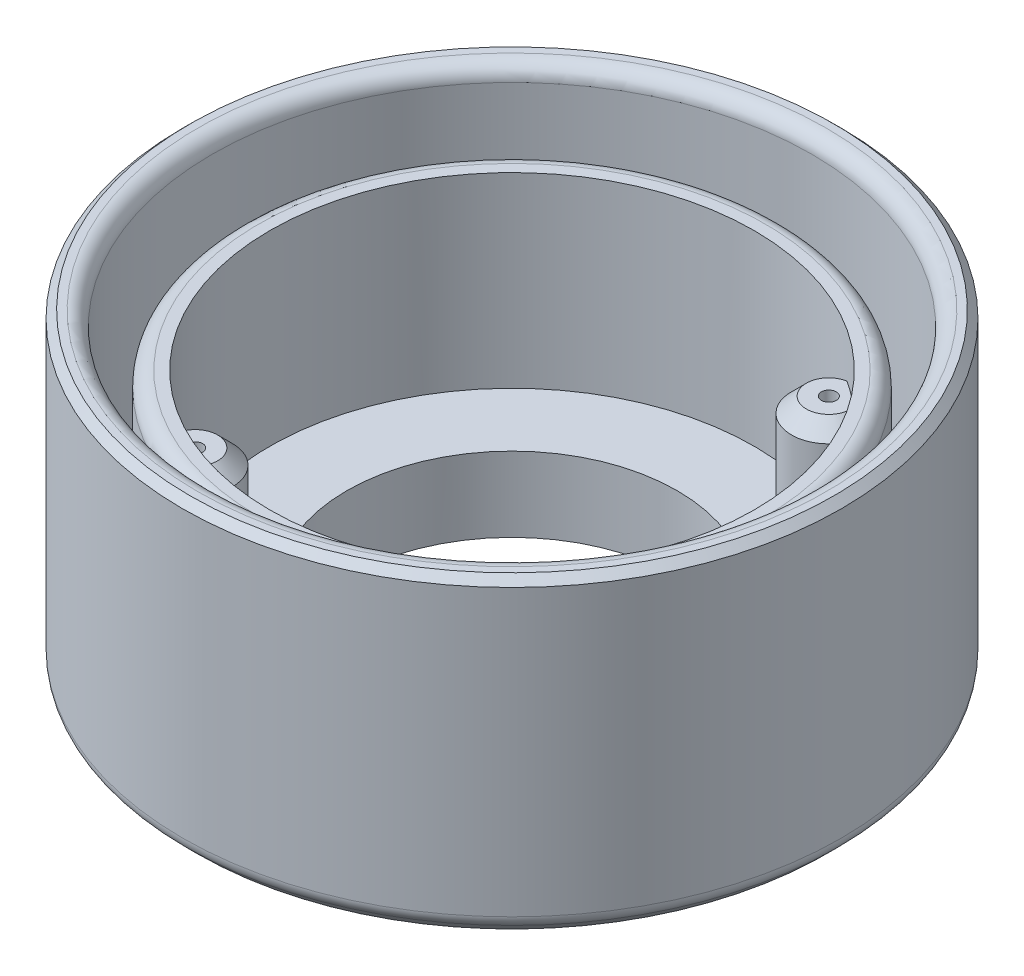
from build123d import *
from OCP.BRepFilletAPI import BRepFilletAPI_MakeChamfer

# Parameters (mm, degrees)
CROQUIS1_R              = 22.05
CROQUIS1_R_2            = 20.05
SALIENTE_EXTRUIR1_DEPTH = 16
CROQUIS1_4_R            = 17.95
CROQUIS1_4_R_2          = 16.2
SALIENTE_EXTRUIR2_DEPTH = 12.5
SALIENTE_EXTRUIR4_START = -5
CROQUIS1_6_R            = 22.05
CROQUIS1_6_R_2          = 20.05
CROQUIS1_6_R_3          = 17.95
CROQUIS1_6_R_4          = 16.2
SALIENTE_EXTRUIR4_DEPTH = 5
CORTAR_EXTRUIR1_REACH   = 39.595
CROQUIS4_R              = 11.05
CROQUIS4_R_2            = 0.5
CROQUIS5_R              = 2.5
CROQUIS5_R_2            = 0.5
CORTAR_EXTRUIR2_DEPTH   = 4.5
CROQUIS6_R              = 2.5
CROQUIS6_R_2            = 0.5
SALIENTE_EXTRUIR5_DEPTH = 10
REDONDEO2_R             = 1
CHAFL_N1_SIZE           = 1
REDONDEO3_R             = 1
CHAFL_N2_SIZE           = 0.5
CHAFL_N3_SIZE           = 2
CHAFL_N3_SIZE_2         = 1.154700538


with BuildPart() as part:
    # Croquis1 → Saliente-Extruir1 (new body)
    with BuildSketch(Plane(origin=(0, 0, 0), x_dir=(1, 0, 0), z_dir=(0, 1, 0))):
        with Locations(Location((0, 0, 0), (0, 0, 270))):
            Circle(CROQUIS1_R)
        with Locations(Location((0, 0, 0), (0, 0, 270))):
            Circle(CROQUIS1_R_2, mode=Mode.SUBTRACT)
    extrude(amount=SALIENTE_EXTRUIR1_DEPTH)



with BuildPart() as body_2:
    # Croquis1<4> → Saliente-Extruir2 (new body)
    with BuildSketch(Plane(origin=(0, 0, 0), x_dir=(1, 0, 0), z_dir=(0, 1, 0))):
        with Locations(Location((0, 0, 0), (0, 0, 270))):
            Circle(CROQUIS1_4_R)
        with Locations(Location((0, 0, 0), (0, 0, 270))):
            Circle(CROQUIS1_4_R_2, mode=Mode.SUBTRACT)
    extrude(amount=SALIENTE_EXTRUIR2_DEPTH)


with BuildPart() as part_1:
    add(part.part)

    add(body_2.part)  # Saliente-Extruir4 merges body 2
    # Croquis1<6> → Saliente-Extruir4 (add)
    # profile 1 of 4: a face of its own
    with BuildSketch(Plane(origin=(0, 0, 0), x_dir=(1, 0, 0), z_dir=(0, 1, 0)).offset(SALIENTE_EXTRUIR4_START)):
        with Locations(Location((0, 0, 0), (0, 0, 270))):
            Circle(CROQUIS1_6_R)
        with Locations(Location((0, 0, 0), (0, 0, 270))):
            Circle(CROQUIS1_6_R_2, mode=Mode.SUBTRACT)
    # profile 2 of 4: a face of its own
    with BuildSketch(Plane(origin=(0, 0, 0), x_dir=(1, 0, 0), z_dir=(0, 1, 0)).offset(SALIENTE_EXTRUIR4_START)):
        with Locations(Location((0, 0, 0), (0, 0, 270))):
            Circle(CROQUIS1_6_R_2)
        with Locations(Location((0, 0, 0), (0, 0, 270))):
            Circle(CROQUIS1_6_R_3, mode=Mode.SUBTRACT)
    # profile 3 of 4: a face of its own
    with BuildSketch(Plane(origin=(0, 0, 0), x_dir=(1, 0, 0), z_dir=(0, 1, 0)).offset(SALIENTE_EXTRUIR4_START)):
        with Locations(Location((0, 0, 0), (0, 0, 270))):
            Circle(CROQUIS1_6_R_3)
        with Locations(Location((0, 0, 0), (0, 0, 270))):
            Circle(CROQUIS1_6_R_4, mode=Mode.SUBTRACT)
    # profile 4 of 4: a face of its own
    with BuildSketch(Plane(origin=(0, 0, 0), x_dir=(1, 0, 0), z_dir=(0, 1, 0)).offset(SALIENTE_EXTRUIR4_START)):
        with Locations(Location((0, 0, 0), (0, 0, 270))):
            Circle(CROQUIS1_6_R_4)
    extrude(amount=SALIENTE_EXTRUIR4_DEPTH)

    # Croquis4 → Cortar-Extruir1 (cut, up to next)
    with BuildSketch(Plane.XZ.offset(5), mode=Mode.PRIVATE) as cortar_extruir1_sk1:
        with Locations(Location((0, 0, 0), (0, 0, 270))):
            Circle(CROQUIS4_R)
    cortar_extruir1_tool1 = extrude(cortar_extruir1_sk1.sketch, amount=-CORTAR_EXTRUIR1_REACH, mode=Mode.PRIVATE) & part_1.part
    # Croquis4 → Cortar-Extruir1 (cut, up to next)
    with BuildSketch(Plane.XZ.offset(5), mode=Mode.PRIVATE) as cortar_extruir1_sk2:
        with Locations(Location((-9.1, 12.1, 0), (0, 0, 270))):
            Circle(CROQUIS4_R_2)
    cortar_extruir1_tool2 = extrude(cortar_extruir1_sk2.sketch, amount=-CORTAR_EXTRUIR1_REACH, mode=Mode.PRIVATE) & part_1.part
    # Croquis4 → Cortar-Extruir1 (cut, up to next)
    with BuildSketch(Plane.XZ.offset(5), mode=Mode.PRIVATE) as cortar_extruir1_sk3:
        with Locations(Location((9.1, -12.1, 0), (0, 0, 270))):
            Circle(CROQUIS4_R_2)
    cortar_extruir1_tool3 = extrude(cortar_extruir1_sk3.sketch, amount=-CORTAR_EXTRUIR1_REACH, mode=Mode.PRIVATE) & part_1.part
    add(cortar_extruir1_tool1.solids().sort_by_distance((0, -5, 0))[0], mode=Mode.SUBTRACT)
    add(cortar_extruir1_tool2.solids().sort_by_distance((-9.1, -5, 12.1))[0], mode=Mode.SUBTRACT)
    add(cortar_extruir1_tool3.solids().sort_by_distance((9.1, -5, -12.1))[0], mode=Mode.SUBTRACT)

    # Croquis5 → Cortar-Extruir2 (cut)
    # profile 1 of 2: a face of its own
    with BuildSketch(Plane.XZ.offset(5)):
        with Locations(Location((-9.1, 12.1, 0), (0, 0, 270))):
            Circle(CROQUIS5_R)
        with Locations(Location((-9.1, 12.1, 0), (0, 0, 270))):
            Circle(CROQUIS5_R_2, mode=Mode.SUBTRACT)
    # profile 2 of 2: a face of its own
    with BuildSketch(Plane.XZ.offset(5)):
        with Locations(Location((9.1, -12.1, 0), (0, 0, 270))):
            Circle(CROQUIS5_R)
        with Locations(Location((9.1, -12.1, 0), (0, 0, 270))):
            Circle(CROQUIS5_R_2, mode=Mode.SUBTRACT)
    extrude(amount=-CORTAR_EXTRUIR2_DEPTH, mode=Mode.SUBTRACT)

    # Croquis6 → Saliente-Extruir5 (add)
    # profile 1 of 2: a face of its own
    with BuildSketch(Plane.XZ.offset(0.5)):
        with Locations(Location((-9.1, 12.1, 0), (0, 0, 270))):
            Circle(CROQUIS6_R)
        with Locations(Location((-9.1, 12.1, 0), (0, 0, 270))):
            Circle(CROQUIS6_R_2, mode=Mode.SUBTRACT)
    # profile 2 of 2: a face of its own
    with BuildSketch(Plane.XZ.offset(0.5)):
        with Locations(Location((9.1, -12.1, 0), (0, 0, 270))):
            Circle(CROQUIS6_R)
        with Locations(Location((9.1, -12.1, 0), (0, 0, 270))):
            Circle(CROQUIS6_R_2, mode=Mode.SUBTRACT)
    extrude(amount=-SALIENTE_EXTRUIR5_DEPTH)

    # Redondeo2
    redondeo2_edges = [part_1.edges().sort_by_distance(p)[0] for p in [
        (0, 12.5, -17.95),
        (0, 16, -20.05),
    ]]
    fillet(redondeo2_edges, radius=REDONDEO2_R)

    # Chaflán1
    chafl_n1_edges = [part_1.edges().sort_by_distance(p)[0] for p in [
        (-9.1, -5, 14.6),
        (9.1, -5, -9.6),
        (-7.597359303, 9.5, 10.101983249),
        (7.597359303, 9.5, -10.101983249),
        (0, -5, -22.05),
    ]]
    chamfer(chafl_n1_edges, length=CHAFL_N1_SIZE)

    # Redondeo3
    redondeo3_edges = [part_1.edges().sort_by_distance(p)[0] for p in [
        (0, -4, -22.05),
    ]]
    fillet(redondeo3_edges, radius=REDONDEO3_R)

    # Chaflán2
    chafl_n2_edges = [part_1.edges().sort_by_distance(p)[0] for p in [
        (0, 16, -22.05),
    ]]
    chamfer(chafl_n2_edges, length=CHAFL_N2_SIZE)

    # Chaflán3
    chafl_n3_edges_1 = [part_1.edges().sort_by_distance(p)[0] for p in [
        (-9.1, -0.5, 12.6),
    ]]
    chafl_n3_side_1 = [part_1.faces().sort_by_distance(p)[0] for p in [
        (-9.1, -0.5, 12.623094011),
    ]]
    chafl_n3_edges_2 = [part_1.edges().sort_by_distance(p)[0] for p in [
        (9.1, -0.5, -11.6),
    ]]
    chafl_n3_side_2 = [part_1.faces().sort_by_distance(p)[0] for p in [
        (9.1, -0.5, -11.576905989),
    ]]
    chafl_n3 = BRepFilletAPI_MakeChamfer(part_1.part.solid().wrapped)
    for e in chafl_n3_edges_1:
        chafl_n3.Add(CHAFL_N3_SIZE - 0.0001, CHAFL_N3_SIZE_2 - 0.0001, e.wrapped, chafl_n3_side_1[0].wrapped)
    for e in chafl_n3_edges_2:
        chafl_n3.Add(CHAFL_N3_SIZE - 0.0001, CHAFL_N3_SIZE_2 - 0.0001, e.wrapped, chafl_n3_side_2[0].wrapped)
    add(Compound.cast(chafl_n3.Shape()), mode=Mode.REPLACE)  # a hair under: the kernel refuses the full size


solid = part_1.part
